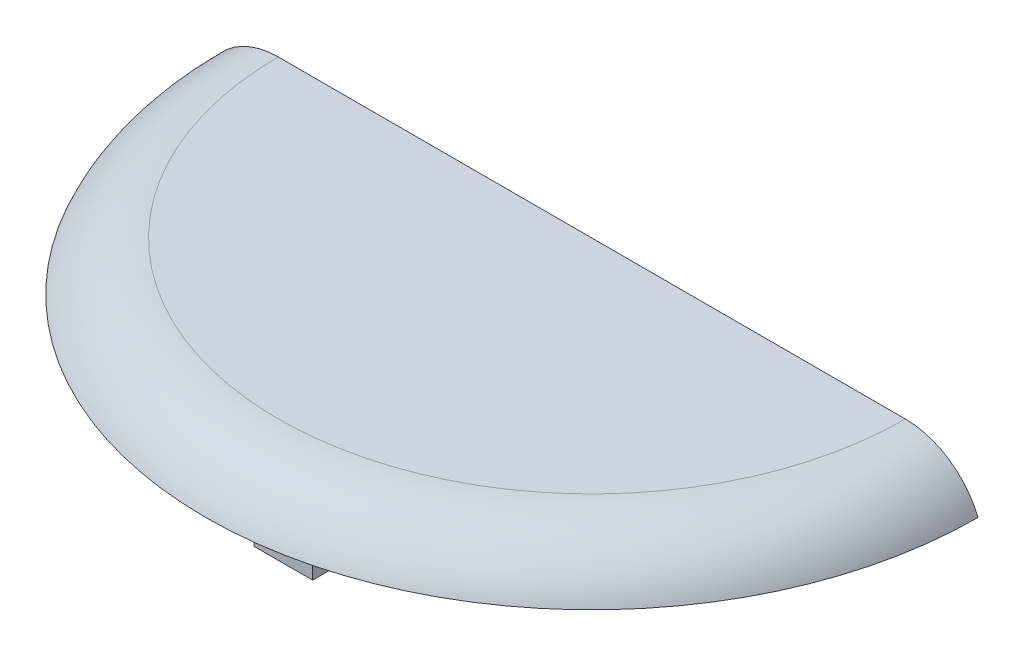
from build123d import *

# Parameters (mm, degrees)
CUT_EXTRUDE3_DEPTH           = 60
CUT_EXTRUDE5_DEPTH           = 2
CUT_EXTRUDE5_DEPTH_BACK      = 30
SKETCH9_R                    = 38
SKETCH9_R_2                  = 23
SKETCH19_W                   = 12
SKETCH19_H                   = 36.5
CUT_REVOLVE2_ANGLE           = 65
CUT_REVOLVE2_OTHER_WAY_ANGLE = 65
SKETCH21_W                   = 3.25
SKETCH21_H                   = 4
BOSS_EXTRUDE3_DEPTH          = 1.35
CIRPATTERN1_COUNT            = 5
CUT_EXTRUDE9_START           = -5
CUT_EXTRUDE9_DEPTH           = 5
SKETCH23_R                   = 10.5
CUT_EXTRUDE10_DEPTH          = 10
SKETCH24_W                   = 15
SKETCH24_H                   = 8
BOSS_EXTRUDE4_DEPTH          = 8
SKETCH26_W                   = 10
SKETCH26_H                   = 6
CUT_EXTRUDE11_DEPTH          = 10
SKETCH27_W                   = 4
SKETCH27_H                   = 5
CUT_EXTRUDE12_DEPTH          = 5
CUT_EXTRUDE14_DEPTH          = 2
CUT_EXTRUDE14_DEPTH_BACK     = 30
SKETCH29_R                   = 1
CUT_EXTRUDE15_DEPTH          = 15
FILLET1_R                    = 6
FILLET2_R                    = 8
INTERSECT1_DEPTH             = 58.427876097
SKETCH31_W                   = 6
SKETCH31_H                   = 3
BOSS_EXTRUDE7_DEPTH          = 8


# Read off the part's stored shape, not the designer's step: Cut-Extrude9, Intersect1
with BuildPart() as part:
    # Sketch1 → Revolve1 (revolve)
    with BuildSketch(Plane.XY, mode=Mode.PRIVATE) as revolve1_sk:
        with BuildLine():
            Line((0, 63.427876097), (32, 63.427876097))
            ThreePointArc((32, 63.427876097), (37.656854249, 61.084730346), (40, 55.427876097))
            Line((40, 55.427876097), (40, 28.846818009))
            ThreePointArc((40, 28.846818009), (38.792081772, 24.082439968), (35.460140376, 20.469057744))
            Line((35.460140376, 20.469057744), (28.539859624, 15.958818353))
            ThreePointArc((28.539859624, 15.958818353), (25.207918228, 12.345436129), (24, 7.581058088))
            Line((24, 7.581058088), (24, 3.25))
            Line((24, 3.25), (24.35, 3))
            Line((24.35, 3), (24.35, 0))
            Line((24.35, 0), (22.5, 0))
            Line((22.5, 0), (22.5, 12.5))
            ThreePointArc((22.5, 12.5), (22.353553391, 12.853553391), (22, 13))
            Line((22, 13), (0, 13))
            Line((0, 13), (0, 63.427876097))
        make_face()
    revolve(revolve1_sk.sketch.rotate(Axis((0, 0, 0), (0, 1, 0)), 90), axis=Axis((0, 0, 0), (0, 1, 0)))

    # Sketch11 → Cut-Extrude3 (cut)
    with BuildSketch(Plane(origin=(0, 13, 0), x_dir=(-1, 0, 0), z_dir=(0, -1, 0))):
        with BuildLine():
            Line((-21, 0), (21, 0))
            ThreePointArc((21, 0), (0, 21), (-21, 0))
        make_face()
    extrude(amount=-CUT_EXTRUDE3_DEPTH, mode=Mode.SUBTRACT)

    # Sketch9 → Cut-Extrude5 (cut, two sides: drawn at the far end of the back side and taken through both)
    with BuildSketch(Plane(origin=(0, 55.427876097, 0), x_dir=(1, 0, 0), z_dir=(0, 1, 0)).offset(-CUT_EXTRUDE5_DEPTH_BACK)):
        with Locations(Location((0, 0, 0), (0, 0, 270))):
            Circle(SKETCH9_R)
        with Locations(Location((0, 0, 0), (0, 0, 270))):
            Circle(SKETCH9_R_2, mode=Mode.SUBTRACT)
    extrude(amount=CUT_EXTRUDE5_DEPTH + CUT_EXTRUDE5_DEPTH_BACK, mode=Mode.SUBTRACT)

    # Sketch19 → Cut-Revolve2 (revolve, cut)
    with BuildSketch(Plane(origin=(0, 0, 0), x_dir=(0, 0, -1), z_dir=(1, 0, 0))):
        with Locations((-41.064715832, 37.177876097)):
            Rectangle(SKETCH19_W, SKETCH19_H)
    revolve(axis=Axis((0, 0, 0), (0, 1, 0)), revolution_arc=CUT_REVOLVE2_ANGLE, mode=Mode.SUBTRACT)

    # Sketch19 → Cut-Revolve2 other way (revolve, cut)
    with BuildSketch(Plane(origin=(0, 0, 0), x_dir=(0, 0, -1), z_dir=(1, 0, 0))):
        with Locations((-41.064715832, 37.177876097)):
            Rectangle(SKETCH19_W, SKETCH19_H)
    revolve(axis=Axis((0, 0, 0), (0, -1, 0)), revolution_arc=CUT_REVOLVE2_OTHER_WAY_ANGLE, mode=Mode.SUBTRACT)

    # Sketch21 → Boss-Extrude3 (add)
    with BuildSketch(Plane(origin=(0, 0, 22.5), x_dir=(-1, 0, 0), z_dir=(0, 0, -1))):
        with Locations((0, 2)):
            Rectangle(SKETCH21_W, SKETCH21_H)
    boss_extrude3 = extrude(amount=BOSS_EXTRUDE3_DEPTH)

    # CirPattern1: Boss-Extrude3 ×5 about axis
    cirpattern1_axis = Axis((0, 0, 0), (0, 1, 0))
    for i in range(1, CIRPATTERN1_COUNT):
        add(boss_extrude3.rotate(cirpattern1_axis, i * 360 / CIRPATTERN1_COUNT))

    # Cut-Extrude9 outline → Cut-Extrude9 (cut)
    with BuildSketch(Plane(origin=(0, 63.427876097, 0), x_dir=(1, 0, 0), z_dir=(0, 1, 0)).offset(CUT_EXTRUDE9_START)):
        with BuildLine():
            ThreePointArc((40, 0), (0, 40), (-40, 0))
            Line((-40, 0), (-21, 0))
            ThreePointArc((-21, 0), (0, 21), (21, 0))
            Line((21, 0), (40, 0))
        make_face()
    extrude(amount=CUT_EXTRUDE9_DEPTH, mode=Mode.SUBTRACT)

    # Sketch23 → Cut-Extrude10 (cut)
    with BuildSketch(Plane(origin=(0, 0, -40), x_dir=(-1, 0, 0), z_dir=(0, 0, -1))):
        with Locations((0, 42.137876097)):
            Circle(SKETCH23_R)
    extrude(amount=-CUT_EXTRUDE10_DEPTH, mode=Mode.SUBTRACT)

    # Sketch24 → Boss-Extrude4 (add)
    with BuildSketch(Plane(origin=(0, 58.427876097, 0), x_dir=(1, 0, 0), z_dir=(0, 1, 0))):
        with Locations((0, 30)):
            Rectangle(SKETCH24_W, SKETCH24_H)
    extrude(amount=-BOSS_EXTRUDE4_DEPTH)

    # Sketch26 → Cut-Extrude11 (cut)
    with BuildSketch(Plane(origin=(0, 58.427876097, 0), x_dir=(1, 0, 0), z_dir=(0, 1, 0))):
        with Locations((0, 30)):
            Rectangle(SKETCH26_W, SKETCH26_H)
    extrude(amount=-CUT_EXTRUDE11_DEPTH, mode=Mode.SUBTRACT)

    # Sketch27 → Cut-Extrude12 (cut)
    with BuildSketch(Plane(origin=(7.5, 0, 0), x_dir=(0, 0, -1), z_dir=(1, 0, 0))):
        with Locations((30, 53.927876097)):
            Rectangle(SKETCH27_W, SKETCH27_H)
    extrude(amount=-CUT_EXTRUDE12_DEPTH, mode=Mode.SUBTRACT)

    # Sketch28 → Cut-Extrude14 (cut, two sides: drawn at the far end of the back side and taken through both)
    with BuildSketch(Plane(origin=(0, 55.427876097, 0), x_dir=(1, 0, 0), z_dir=(0, 1, 0)).offset(-CUT_EXTRUDE14_DEPTH_BACK)):
        with BuildLine():
            Line((-22.912878475, -2), (22.912878475, -2))
            ThreePointArc((22.912878475, -2), (0, -23), (-22.912878475, -2))
        make_face()
    extrude(amount=CUT_EXTRUDE14_DEPTH + CUT_EXTRUDE14_DEPTH_BACK, mode=Mode.SUBTRACT)

    # Sketch29 → Cut-Extrude15 (cut)
    with BuildSketch(Plane(origin=(0, 0, 0), x_dir=(-1, 0, 0), z_dir=(0, 0, -1))):
        with Locations((-30.416198487, 60.927876097)):
            Circle(SKETCH29_R)
        with Locations((30.416198487, 60.927876097)):
            Circle(SKETCH29_R)
        with Locations((0, 60.927876097)):
            Circle(SKETCH29_R)
    extrude(amount=-CUT_EXTRUDE15_DEPTH, mode=Mode.SUBTRACT)

    # Fillet1
    fillet1_edges = [part.edges().sort_by_distance(p)[0] for p in [
        (21, 35.713938048, 0),
        (-21, 35.713938048, 0),
    ]]
    fillet(fillet1_edges, radius=FILLET1_R)

    # Fillet2
    fillet2_edges = [part.edges().sort_by_distance(p)[0] for p in [
        (-22.912878475, 41.427876097, 2),
        (22.912878475, 41.427876097, 2),
    ]]
    fillet(fillet2_edges, radius=FILLET2_R)

    # Intersect1 outline → Intersect1 (cut)
    with BuildSketch(Plane(origin=(0, 0, 0), x_dir=(1, 0, 0), z_dir=(0, 1, 0))):
        with BuildLine():
            Line((-37.508702776, -13.895942431), (-42, -15.355253362))
            Line((-42, -15.355253362), (-42, -41))
            Line((-42, -41), (42, -41))
            Line((42, -41), (42, -15.355253362))
            Line((42, -15.355253362), (37.508702776, -13.895942431))
            ThreePointArc((37.508702776, -13.895942431), (0, 40), (-37.508702776, -13.895942431))
        make_face()
        with BuildLine():
            ThreePointArc((19.246817919, 8.4), (18.767687244, 2.713664655), (13.747727085, 0))
            Line((13.747727085, 0), (-13.747727085, 0))
            ThreePointArc((-13.747727085, 0), (-18.767687244, 2.713664655), (-19.246817919, 8.4))
            ThreePointArc((-19.246817919, 8.4), (0, 21), (19.246817919, 8.4))
        make_face(mode=Mode.SUBTRACT)
    extrude(amount=INTERSECT1_DEPTH, mode=Mode.SUBTRACT)

    # Sketch31 → Boss-Extrude7 (add)
    with BuildSketch(Plane(origin=(0, 58.427876097, 0), x_dir=(1, 0, 0), z_dir=(0, 1, 0))):
        with Locations((0, -30)):
            Rectangle(SKETCH31_W, SKETCH31_H)
    extrude(amount=-BOSS_EXTRUDE7_DEPTH)


solid = part.part
